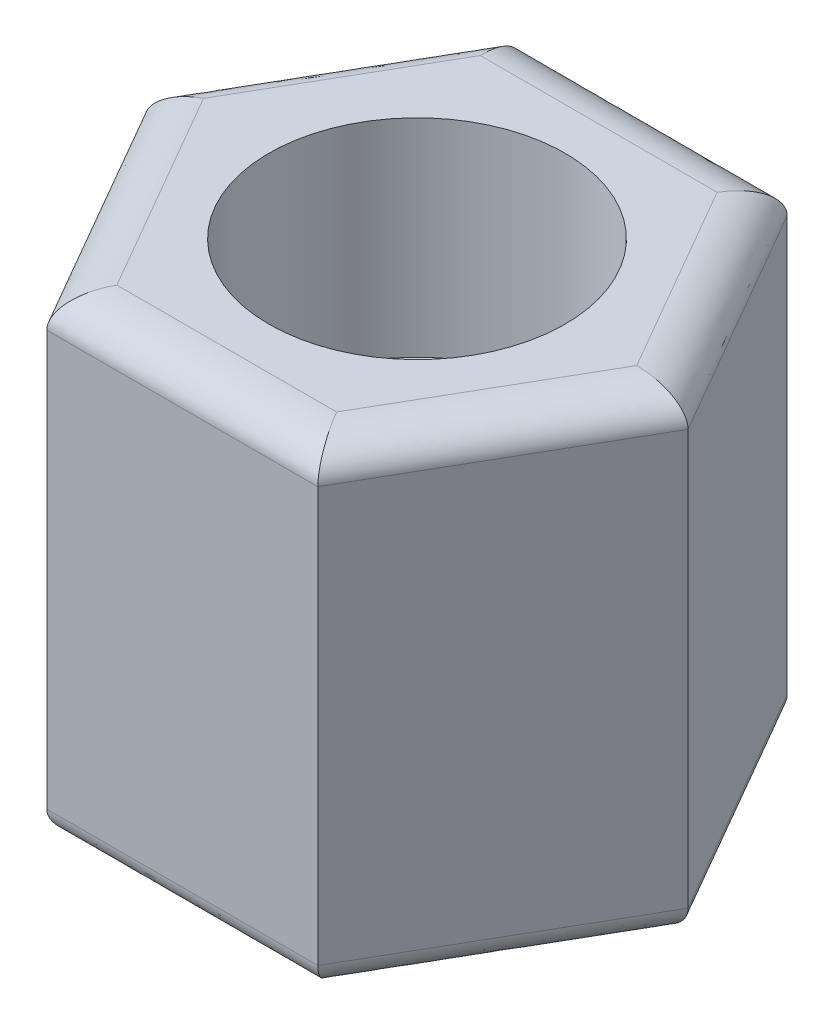
from build123d import *

# Parameters (mm, degrees)
BOSS_EXTRUDE1_DEPTH = 32
SKETCH2_R           = 10
CUT_EXTRUDE1_DEPTH  = 14
CUT_EXTRUDE2_START  = -10
SKETCH3_R           = 10
CUT_EXTRUDE2_DEPTH  = 10
FILLET1_SIZE        = 3
FILLET1_SIZE_2      = 2
FILLET2_SIZE        = 2
FILLET2_SIZE_2      = 3


with BuildPart() as part:
    # Sketch1 → Boss-Extrude1 (new body)
    with BuildSketch(Plane(origin=(0, 0, 0), x_dir=(1, 0, 0), z_dir=(0, 1, 0))):
        Polygon((18.3, 0), (9.15, 15.848264889), (-9.15, 15.848264889), (-18.3, 0), (-9.15, -15.848264889), (9.15, -15.848264889), align=None)
    extrude(amount=BOSS_EXTRUDE1_DEPTH)

    # Sketch2 → Cut-Extrude1 (cut)
    with BuildSketch(Plane(origin=(0, 32, 0), x_dir=(1, 0, 0), z_dir=(0, 1, 0))):
        with Locations(Location((0, 0, 0), (0, 0, 270))):
            Circle(SKETCH2_R)
    extrude(amount=-CUT_EXTRUDE1_DEPTH, mode=Mode.SUBTRACT)

    # Sketch3 → Cut-Extrude2 (cut)
    with BuildSketch(Plane.XZ.offset(CUT_EXTRUDE2_START)):
        with Locations(Location((0, 0, 0), (0, 0, 90))):
            Circle(SKETCH3_R)
    extrude(amount=CUT_EXTRUDE2_DEPTH, mode=Mode.SUBTRACT)

    # Fillet1
    # an asymmetric fillet: 3, 2 mm, written as the material it takes off along each edge
    with BuildSketch(Plane(origin=(-16.65, 0, 15.848264889), x_dir=(0, 0, -1), z_dir=(1, 0, 0)), Plane(origin=(-22.05, 0, -6.495190528), x_dir=(0.8660254037844387, 0, -0.5000000000000001), z_dir=(0.5000000000000001, 0, 0.8660254037844387)), Plane(origin=(-5.4, 0, -22.343455418), x_dir=(0.8660254037844388, 0, 0.49999999999999956), z_dir=(-0.49999999999999956, 0, 0.8660254037844389))) as fillet1_piece_1:
        with BuildLine():
            Bezier((FILLET1_SIZE, 0), (0, 0), (0, FILLET1_SIZE_2), weights=[1, 0.707106781, 1])
            Line((0, FILLET1_SIZE_2), (0, 0))
            Line((0, 0), (FILLET1_SIZE, 0))
        make_face()
    extrude(amount=33.3, mode=Mode.SUBTRACT)
    with BuildSketch(Plane(origin=(16.65, 0, -15.848264889), x_dir=(0, 1, 0), z_dir=(-1, 0, 0)), Plane(origin=(22.05, 0, 6.495190528), x_dir=(0, 1, 0), z_dir=(-0.5000000000000001, 0, -0.8660254037844387)), Plane(origin=(5.4, 0, 22.343455418), x_dir=(0, 1, 0), z_dir=(0.49999999999999983, 0, -0.8660254037844389))) as fillet1_piece_2:
        with BuildLine():
            Bezier((FILLET1_SIZE_2, 0), (0, 0), (0, -FILLET1_SIZE), weights=[1, 0.707106781, 1])
            Line((0, -FILLET1_SIZE), (0, 0))
            Line((0, 0), (FILLET1_SIZE_2, 0))
        make_face()
    extrude(amount=33.3, mode=Mode.SUBTRACT)

    # Fillet2
    # an asymmetric fillet: 3, 2 mm, written as the material it takes off along each edge
    with BuildSketch(Plane(origin=(-5.4, 32, -22.343455418), x_dir=(0.866025403784439, 0, 0.4999999999999996), z_dir=(-0.49999999999999956, 0, 0.8660254037844389))) as fillet2_piece_1:
        with BuildLine():
            Bezier((FILLET2_SIZE, 0), (0, 0), (0, -FILLET2_SIZE_2), weights=[1, 0.707106781, 1])
            Line((0, -FILLET2_SIZE_2), (0, 0))
            Line((0, 0), (FILLET2_SIZE, 0))
        make_face()
    extrude(amount=33.3, mode=Mode.SUBTRACT)
    with BuildSketch(Plane(origin=(16.65, 32, -15.848264889), x_dir=(0, -1, 0), z_dir=(-1, 0, 0)), Plane(origin=(22.05, 32, 6.495190528), x_dir=(0, -1, 0), z_dir=(-0.5000000000000001, 0, -0.8660254037844387))) as fillet2_piece_2:
        with BuildLine():
            Bezier((FILLET2_SIZE, 0), (0, 0), (0, FILLET2_SIZE_2), weights=[1, 0.707106781, 1])
            Line((0, FILLET2_SIZE_2), (0, 0))
            Line((0, 0), (FILLET2_SIZE, 0))
        make_face()
    extrude(amount=33.3, mode=Mode.SUBTRACT)
    with BuildSketch(Plane(origin=(5.4, 32, 22.343455418), x_dir=(-0.8660254037844388, 0, -0.4999999999999998), z_dir=(0.49999999999999983, 0, -0.8660254037844389)), Plane(origin=(-16.65, 32, 15.848264889), x_dir=(0, 0, -1), z_dir=(1, 0, 0)), Plane(origin=(-22.05, 32, -6.495190528), x_dir=(0.8660254037844387, 0, -0.5000000000000001), z_dir=(0.5000000000000001, 0, 0.8660254037844387))) as fillet2_piece_3:
        with BuildLine():
            Bezier((FILLET2_SIZE_2, 0), (0, 0), (0, -FILLET2_SIZE), weights=[1, 0.707106781, 1])
            Line((0, -FILLET2_SIZE), (0, 0))
            Line((0, 0), (FILLET2_SIZE_2, 0))
        make_face()
    extrude(amount=33.3, mode=Mode.SUBTRACT)


solid = part.part
